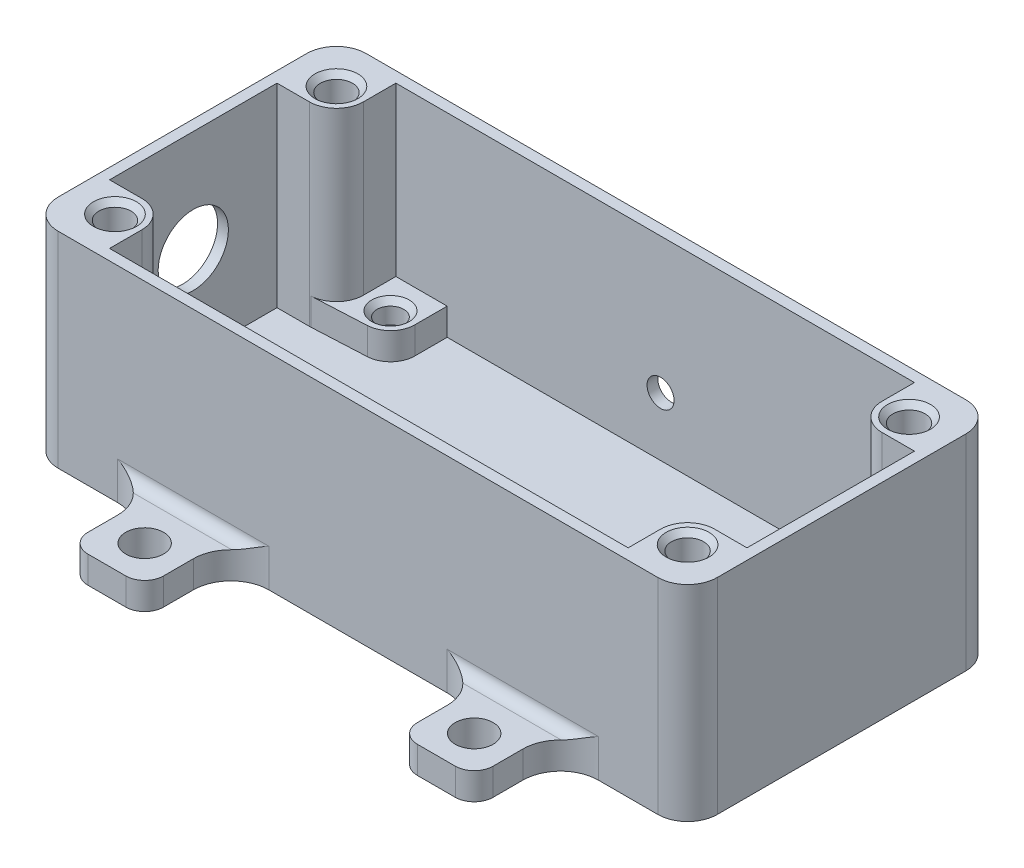
from build123d import *
from build123d.topology import SkipClean

# Parameters (mm, degrees)
SKETCH1_R                 = 4.5
BOSS_EXTRUDE3_DEPTH       = 7
BOSS_EXTRUDE3_2_DEPTH     = 7
BOSS_EXTRUDE3_3_DEPTH     = 7
BOSS_EXTRUDE3_4_DEPTH     = 7
SKETCH7_R                 = 2.475
CUT_EXTRUDE1_DEPTH        = 4
SKETCH8_R                 = 5
BOSS_EXTRUDE5_DEPTH       = 38
BOSS_EXTRUDE5_2_DEPTH     = 38
BOSS_EXTRUDE5_3_DEPTH     = 38
BOSS_EXTRUDE5_4_DEPTH     = 38
SKETCH9_R                 = 2.975
CUT_EXTRUDE2_DEPTH        = 10
SKETCH10_W                = 122
SKETCH10_H                = 57
SKETCH10_W_2              = 118
SKETCH10_H_2              = 53
BOSS_EXTRUDE12_DEPTH      = 38
SKETCH15_W                = 122
SKETCH15_H                = 57
BOSS_EXTRUDE14_DEPTH      = 2
FILLET2_R                 = 5.5
BOSS_EXTRUDE15_START      = 5
SKETCH16_R                = 2.475
SKETCH16_R_2              = 2.975
BOSS_EXTRUDE15_DEPTH      = 5
BOSS_EXTRUDE16_START      = 31
SKETCH17_R                = 2.975
BOSS_EXTRUDE16_DEPTH      = 31
MIRROR2_START             = 5
MIRROR2_COPY_1_SKETCH_R   = 2.475
MIRROR2_COPY_1_SKETCH_R_2 = 2.975
MIRROR2_COPY_1_DEPTH      = 5
MIRROR2_START_2           = 31
MIRROR2_COPY_2_SKETCH_R   = 2.975
MIRROR2_COPY_2_DEPTH      = 31
CUT_EXTRUDE3_REACH        = 93.728
SKETCH18_R                = 2.5
CUT_EXTRUDE4_REACH        = 132.921
SKETCH19_R                = 6.5
SKETCH20_W                = 14
SKETCH20_H                = 16
SKETCH20_R                = 3.5
BOSS_EXTRUDE17_DEPTH      = 5
MIRROR8_COPY_1_SKETCH_W   = 14
MIRROR8_COPY_1_SKETCH_H   = 16
MIRROR8_COPY_1_SKETCH_R   = 3.5
MIRROR8_COPY_1_DEPTH      = 5
FILLET3_R                 = 2
FILLET4_R                 = 7
FILLET5_R                 = 3.5
CHAMFER1_SIZE             = 1


with BuildPart() as part:
    # Sketch1 → Boss-Extrude3 (new body)
    with BuildSketch(Plane(origin=(0, 0, 0), x_dir=(1, 0, 0), z_dir=(0, 1, 0))):
        with Locations(Location((-43, 20.5, 0), (0, 0, 270))):
            Circle(SKETCH1_R)
    extrude(amount=BOSS_EXTRUDE3_DEPTH)


with BuildPart() as body_2:
    # Sketch1 → Boss-Extrude3 2 (new body)
    with BuildSketch(Plane(origin=(0, 0, 0), x_dir=(1, 0, 0), z_dir=(0, 1, 0))):
        with Locations(Location((43, 20.5, 0), (0, 0, 270))):
            Circle(SKETCH1_R)
    extrude(amount=BOSS_EXTRUDE3_2_DEPTH)


with BuildPart() as body_3:
    # Sketch1 → Boss-Extrude3 3 (new body)
    with BuildSketch(Plane(origin=(0, 0, 0), x_dir=(1, 0, 0), z_dir=(0, 1, 0))):
        with Locations(Location((43, -20.5, 0), (0, 0, 270))):
            Circle(SKETCH1_R)
    extrude(amount=BOSS_EXTRUDE3_3_DEPTH)


with BuildPart() as body_4:
    # Sketch1 → Boss-Extrude3 4 (new body)
    with BuildSketch(Plane(origin=(0, 0, 0), x_dir=(1, 0, 0), z_dir=(0, 1, 0))):
        with Locations(Location((-43, -20.5, 0), (0, 0, 270))):
            Circle(SKETCH1_R)
    extrude(amount=BOSS_EXTRUDE3_4_DEPTH)


with BuildPart() as cut_extrude1_tool:
    # Sketch7 → Cut-Extrude1 (new body)
    with BuildSketch(Plane(origin=(0, 7, 0), x_dir=(1, 0, 0), z_dir=(0, 1, 0))):
        with Locations(Location((-43, 20.5, 0), (0, 0, 270))):
            Circle(SKETCH7_R)
        with Locations(Location((43, 20.5, 0), (0, 0, 270))):
            Circle(SKETCH7_R)
        with Locations(Location((43, -20.5, 0), (0, 0, 270))):
            Circle(SKETCH7_R)
        with Locations(Location((-43, -20.5, 0), (0, 0, 270))):
            Circle(SKETCH7_R)
    extrude(amount=-CUT_EXTRUDE1_DEPTH)


with BuildPart() as part_1:
    add(part.part)

    # Cut-Extrude1: cut by cut_extrude1_tool
    add(cut_extrude1_tool.part, mode=Mode.SUBTRACT)



with BuildPart() as body_2_1:
    add(body_2.part)

    # Cut-Extrude1: cut by cut_extrude1_tool
    add(cut_extrude1_tool.part, mode=Mode.SUBTRACT)


with BuildPart() as body_3_1:
    add(body_3.part)

    # Cut-Extrude1: cut by cut_extrude1_tool
    add(cut_extrude1_tool.part, mode=Mode.SUBTRACT)


with BuildPart() as body_4_1:
    add(body_4.part)

    # Cut-Extrude1: cut by cut_extrude1_tool
    add(cut_extrude1_tool.part, mode=Mode.SUBTRACT)


with BuildPart() as body_5:
    # Sketch8 → Boss-Extrude5 (new body)
    with BuildSketch(Plane(origin=(0, 0, 0), x_dir=(1, 0, 0), z_dir=(0, 1, 0))):
        with Locations(Location((-53, 20.5, 0), (0, 0, 270))):
            Circle(SKETCH8_R)
    extrude(amount=BOSS_EXTRUDE5_DEPTH)


with BuildPart() as body_6:
    # Sketch8 → Boss-Extrude5 2 (new body)
    with BuildSketch(Plane(origin=(0, 0, 0), x_dir=(1, 0, 0), z_dir=(0, 1, 0))):
        with Locations(Location((-53, -20.5, 0), (0, 0, 90))):
            Circle(SKETCH8_R)
    extrude(amount=BOSS_EXTRUDE5_2_DEPTH)


with BuildPart() as body_7:
    # Sketch8 → Boss-Extrude5 3 (new body)
    with BuildSketch(Plane(origin=(0, 0, 0), x_dir=(1, 0, 0), z_dir=(0, 1, 0))):
        with Locations(Location((53, -20.5, 0), (0, 0, 270))):
            Circle(SKETCH8_R)
    extrude(amount=BOSS_EXTRUDE5_3_DEPTH)


with BuildPart() as body_8:
    # Sketch8 → Boss-Extrude5 4 (new body)
    with BuildSketch(Plane(origin=(0, 0, 0), x_dir=(1, 0, 0), z_dir=(0, 1, 0))):
        with Locations(Location((53, 20.5, 0), (0, 0, 90))):
            Circle(SKETCH8_R)
    extrude(amount=BOSS_EXTRUDE5_4_DEPTH)


with BuildPart() as cut_extrude2_tool:
    # Sketch9 → Cut-Extrude2 (new body)
    with BuildSketch(Plane(origin=(0, 38, 0), x_dir=(1, 0, 0), z_dir=(0, 1, 0))):
        with Locations(Location((-53, 20.5, 0), (0, 0, 270))):
            Circle(SKETCH9_R)
        with Locations(Location((-53, -20.5, 0), (0, 0, 270))):
            Circle(SKETCH9_R)
        with Locations(Location((53, 20.5, 0), (0, 0, 270))):
            Circle(SKETCH9_R)
        with Locations(Location((53, -20.5, 0), (0, 0, 270))):
            Circle(SKETCH9_R)
    extrude(amount=-CUT_EXTRUDE2_DEPTH)


with BuildPart() as body_5_1:
    add(body_5.part)

    # Cut-Extrude2: cut by cut_extrude2_tool
    add(cut_extrude2_tool.part, mode=Mode.SUBTRACT)


with BuildPart() as body_6_1:
    add(body_6.part)

    # Cut-Extrude2: cut by cut_extrude2_tool
    add(cut_extrude2_tool.part, mode=Mode.SUBTRACT)


with BuildPart() as body_7_1:
    add(body_7.part)

    # Cut-Extrude2: cut by cut_extrude2_tool
    add(cut_extrude2_tool.part, mode=Mode.SUBTRACT)


with BuildPart() as body_8_1:
    add(body_8.part)

    # Cut-Extrude2: cut by cut_extrude2_tool
    add(cut_extrude2_tool.part, mode=Mode.SUBTRACT)


with BuildPart() as body_9:
    # Sketch10 → Boss-Extrude12 (new body)
    with BuildSketch(Plane(origin=(0, 0, 0), x_dir=(1, 0, 0), z_dir=(0, 1, 0))):
        Rectangle(SKETCH10_W, SKETCH10_H)
        Rectangle(SKETCH10_W_2, SKETCH10_H_2, mode=Mode.SUBTRACT)
    extrude(amount=BOSS_EXTRUDE12_DEPTH)


with BuildPart() as part_2:
    add(part_1.part)

    add(body_2_1.part)  # Boss-Extrude14 merges body 2

    add(body_3_1.part)  # Boss-Extrude14 merges body 3

    add(body_4_1.part)  # Boss-Extrude14 merges body 4

    add(body_5_1.part)  # Boss-Extrude14 merges body 5

    add(body_6_1.part)  # Boss-Extrude14 merges body 6

    add(body_7_1.part)  # Boss-Extrude14 merges body 7

    add(body_8_1.part)  # Boss-Extrude14 merges body 8

    add(body_9.part)  # Boss-Extrude14 merges body 9
    # Sketch15 → Boss-Extrude14 (add)
    with BuildSketch(Plane(origin=(0, 0, 0), x_dir=(1, 0, 0), z_dir=(0, 1, 0))):
        Rectangle(SKETCH15_W, SKETCH15_H)
    extrude(amount=BOSS_EXTRUDE14_DEPTH)

    # Fillet2
    fillet2_edges = [part_2.edges().sort_by_distance(p)[0] for p in [
        (-61, 19, 28.5),
        (61, 19, 28.5),
        (61, 19, -28.5),
        (-61, 19, -28.5),
        (-59, 20, -26.5),
        (59, 20, -26.5),
        (59, 20, 26.5),
        (-59, 20, 26.5),
    ]]
    fillet(fillet2_edges, radius=FILLET2_R)

    # Sketch16 → Boss-Extrude15 (add)
    with BuildSketch(Plane(origin=(0, 2, 0), x_dir=(1, 0, 0), z_dir=(0, 1, 0)).offset(BOSS_EXTRUDE15_START)):
        with BuildLine():
            Line((-59, 15.5), (-59, 21))
            ThreePointArc((-59, 21), (-57.389087297, 24.889087297), (-53.5, 26.5))
            Line((-53.5, 26.5), (-38.5, 26.5))
            Line((-38.5, 26.5), (-38.5, 20.5))
            ThreePointArc((-38.5, 20.5), (-39.739440232, 17.398589031), (-42.775, 16.00562852))
            Line((-42.775, 16.00562852), (-52.75, 15.506253911))
            ThreePointArc((-52.75, 15.506253911), (-52.874960895, 15.501563722), (-53, 15.5))
            Line((-53, 15.5), (-59, 15.5))
        make_face()
        with Locations(Location((-43, 20.5, 0), (0, 0, 270))):
            Circle(SKETCH16_R, mode=Mode.SUBTRACT)
        with Locations(Location((-53, 20.5, 0), (0, 0, 270))):
            Circle(SKETCH16_R_2, mode=Mode.SUBTRACT)
    boss_extrude15 = extrude(amount=-BOSS_EXTRUDE15_DEPTH)

    # Sketch17 → Boss-Extrude16 (add)
    with BuildSketch(Plane(origin=(0, 7, 0), x_dir=(1, 0, 0), z_dir=(0, 1, 0)).offset(BOSS_EXTRUDE16_START)):
        with BuildLine():
            Line((-59, 15.5), (-53, 15.5))
            ThreePointArc((-53, 15.5), (-49.464466094, 16.964466094), (-48, 20.5))
            Line((-48, 20.5), (-48, 26.5))
            Line((-48, 26.5), (-53.5, 26.5))
            ThreePointArc((-53.5, 26.5), (-57.389087297, 24.889087297), (-59, 21))
            Line((-59, 21), (-59, 15.5))
        make_face()
        with Locations(Location((-53, 20.5, 0), (0, 0, 270))):
            Circle(SKETCH17_R, mode=Mode.SUBTRACT)
    boss_extrude16 = extrude(amount=-BOSS_EXTRUDE16_DEPTH)

    # Mirror1: Boss-Extrude15, Boss-Extrude16 across plane
    with SkipClean():  # the faces are left unmerged after this step: merging them gives an invalid solid
        add(boss_extrude15.mirror(Plane(origin=(0, 0, 0), x_dir=(0, 0, 1), z_dir=(1, 0, 0))))
        add(boss_extrude16.mirror(Plane(origin=(0, 0, 0), x_dir=(0, 0, 1), z_dir=(1, 0, 0))))

    # Mirror2: Boss-Extrude15, Boss-Extrude16 across plane
    with SkipClean():  # the faces are left unmerged after this step: merging them gives an invalid solid
        add(boss_extrude15.mirror(Plane.XY))
        add(boss_extrude16.mirror(Plane.XY))

    # Mirror2 copy 1 sketch → Mirror2 copy 1 (add)
    with SkipClean():  # the faces are left unmerged after this step: merging them gives an invalid solid
        with BuildSketch(Plane(origin=(0, 2, 0), x_dir=(-1, 0, 0), z_dir=(0, 1, 0)).offset(MIRROR2_START)):
            with BuildLine():
                Line((-59, 15.5), (-59, 21))
                ThreePointArc((-59, 21), (-57.389087297, 24.889087297), (-53.5, 26.5))
                Line((-53.5, 26.5), (-38.5, 26.5))
                Line((-38.5, 26.5), (-38.5, 20.5))
                ThreePointArc((-38.5, 20.5), (-39.739440232, 17.398589031), (-42.775, 16.00562852))
                Line((-42.775, 16.00562852), (-52.75, 15.506253911))
                ThreePointArc((-52.75, 15.506253911), (-52.874960895, 15.501563722), (-53, 15.5))
                Line((-53, 15.5), (-59, 15.5))
            make_face()
            with Locations(Location((-43, 20.5, 0), (0, 0, 270))):
                Circle(MIRROR2_COPY_1_SKETCH_R, mode=Mode.SUBTRACT)
            with Locations(Location((-53, 20.5, 0), (0, 0, 270))):
                Circle(MIRROR2_COPY_1_SKETCH_R_2, mode=Mode.SUBTRACT)
        extrude(amount=-MIRROR2_COPY_1_DEPTH)

    # Mirror2 copy 2 sketch → Mirror2 copy 2 (add)
    with SkipClean():  # the faces are left unmerged after this step: merging them gives an invalid solid
        with BuildSketch(Plane(origin=(0, 7, 0), x_dir=(-1, 0, 0), z_dir=(0, 1, 0)).offset(MIRROR2_START_2)):
            with BuildLine():
                Line((-59, 15.5), (-53, 15.5))
                ThreePointArc((-53, 15.5), (-49.464466094, 16.964466094), (-48, 20.5))
                Line((-48, 20.5), (-48, 26.5))
                Line((-48, 26.5), (-53.5, 26.5))
                ThreePointArc((-53.5, 26.5), (-57.389087297, 24.889087297), (-59, 21))
                Line((-59, 21), (-59, 15.5))
            make_face()
            with Locations(Location((-53, 20.5, 0), (0, 0, 270))):
                Circle(MIRROR2_COPY_2_SKETCH_R, mode=Mode.SUBTRACT)
        extrude(amount=-MIRROR2_COPY_2_DEPTH)

    # Sketch18 → Cut-Extrude3 (cut, up to next)
    with BuildSketch(Plane(origin=(0, 0, -28.5), x_dir=(-1, 0, 0), z_dir=(0, 0, -1)), mode=Mode.PRIVATE) as cut_extrude3_sk1:
        with Locations((-1, 12.85)):
            Circle(SKETCH18_R)
    cut_extrude3_tool1 = extrude(cut_extrude3_sk1.sketch, amount=-CUT_EXTRUDE3_REACH, mode=Mode.PRIVATE) & part_2.part
    add(cut_extrude3_tool1.solids().sort_by_distance((1, 12.85, -28.5))[0], mode=Mode.SUBTRACT)

    # Sketch19 → Cut-Extrude4 (cut, up to next)
    with BuildSketch(Plane.ZY.offset(61), mode=Mode.PRIVATE) as cut_extrude4_sk1:
        with Locations((0, 19)):
            Circle(SKETCH19_R)
    cut_extrude4_tool1 = extrude(cut_extrude4_sk1.sketch, amount=-CUT_EXTRUDE4_REACH, mode=Mode.PRIVATE) & part_2.part
    add(cut_extrude4_tool1.solids().sort_by_distance((-61, 19, 0))[0], mode=Mode.SUBTRACT)

    # Sketch20 → Boss-Extrude17 (add)
    with SkipClean():  # the faces are left unmerged after this step: merging them gives an invalid solid
        with BuildSketch(Plane(origin=(0, 0, 0), x_dir=(1, 0, 0), z_dir=(0, 1, 0))):
            with Locations((-30.5, 36.5)):
                Rectangle(SKETCH20_W, SKETCH20_H)
            with Locations(Location((-30.5, 37.5, 0), (0, 0, 270))):
                Circle(SKETCH20_R, mode=Mode.SUBTRACT)
        boss_extrude17 = extrude(amount=BOSS_EXTRUDE17_DEPTH)

    # Mirror6: Boss-Extrude17 across plane
    with SkipClean():  # the faces are left unmerged after this step: merging them gives an invalid solid
        add(boss_extrude17.mirror(Plane.XY))

    # Mirror8: Boss-Extrude17 across plane
    with SkipClean():  # the faces are left unmerged after this step: merging them gives an invalid solid
        add(boss_extrude17.mirror(Plane(origin=(0, 0, 0), x_dir=(0, 0, 1), z_dir=(1, 0, 0))))

    # Mirror8 copy 1 sketch → Mirror8 copy 1 (add)
    with SkipClean():  # the faces are left unmerged after this step: merging them gives an invalid solid
        with BuildSketch(Plane(origin=(0, 0, 0), x_dir=(-1, 0, 0), z_dir=(0, 1, 0))):
            with Locations((-30.5, 36.5)):
                Rectangle(MIRROR8_COPY_1_SKETCH_W, MIRROR8_COPY_1_SKETCH_H)
            with Locations(Location((-30.5, 37.5, 0), (0, 0, 270))):
                Circle(MIRROR8_COPY_1_SKETCH_R, mode=Mode.SUBTRACT)
        extrude(amount=MIRROR8_COPY_1_DEPTH)

    # Fillet3
    fillet3_edges = [part_2.edges().sort_by_distance(p)[0] for p in [
        (-30.5, 5, -28.5),
        (-30.5, 5, 28.5),
        (30.5, 5, 28.5),
        (30.5, 5, -28.5),
    ]]
    fillet(fillet3_edges, radius=FILLET3_R)

    # Fillet4
    fillet4_edges = [part_2.edges().sort_by_distance(p)[0] for p in [
        (-37.5, 6, -28.5),
        (-37.5, 2.5, -28.5),
    ]]
    fillet(fillet4_edges, radius=FILLET4_R)
    fillet4_2_edges = [part_2.edges().sort_by_distance(p)[0] for p in [
        (-23.5, 6, -28.5),
        (-23.5, 2.5, -28.5),
    ]]
    fillet(fillet4_2_edges, radius=FILLET4_R)
    fillet4_3_edges = [part_2.edges().sort_by_distance(p)[0] for p in [
        (23.5, 2.5, -28.5),
        (23.5, 6, -28.5),
    ]]
    fillet(fillet4_3_edges, radius=FILLET4_R)
    fillet4_4_edges = [part_2.edges().sort_by_distance(p)[0] for p in [
        (37.5, 2.5, -28.5),
        (37.5, 6, -28.5),
    ]]
    fillet(fillet4_4_edges, radius=FILLET4_R)
    fillet4_5_edges = [part_2.edges().sort_by_distance(p)[0] for p in [
        (-37.5, 6, 28.5),
        (-37.5, 2.5, 28.5),
    ]]
    fillet(fillet4_5_edges, radius=FILLET4_R)
    fillet4_6_edges = [part_2.edges().sort_by_distance(p)[0] for p in [
        (-23.5, 6, 28.5),
        (-23.5, 2.5, 28.5),
    ]]
    fillet(fillet4_6_edges, radius=FILLET4_R)
    fillet4_7_edges = [part_2.edges().sort_by_distance(p)[0] for p in [
        (23.5, 2.5, 28.5),
        (23.5, 6, 28.5),
    ]]
    fillet(fillet4_7_edges, radius=FILLET4_R)
    fillet4_8_edges = [part_2.edges().sort_by_distance(p)[0] for p in [
        (37.5, 2.5, 28.5),
        (37.5, 6, 28.5),
    ]]
    fillet(fillet4_8_edges, radius=FILLET4_R)

    # Fillet5
    fillet5_edges = [part_2.edges().sort_by_distance(p)[0] for p in [
        (-37.5, 2.5, -44.5),
        (-23.5, 2.5, -44.5),
        (-37.5, 2.5, 44.5),
        (-23.5, 2.5, 44.5),
        (37.5, 2.5, 44.5),
        (23.5, 2.5, 44.5),
        (37.5, 2.5, -44.5),
        (23.5, 2.5, -44.5),
    ]]
    fillet(fillet5_edges, radius=FILLET5_R)

    # Chamfer1
    chamfer1_edges = [part_2.edges().sort_by_distance(p)[0] for p in [
        (-40.525, 7, 20.5),
        (-43, 7, -22.975),
        (43, 7, -22.975),
        (45.475, 7, 20.5),
        (-53, 38, -23.475),
        (-50.025, 38, 20.5),
        (53, 38, -23.475),
        (55.975, 38, 20.5),
    ]]
    chamfer(chamfer1_edges, length=CHAMFER1_SIZE)


solid = part_2.part
